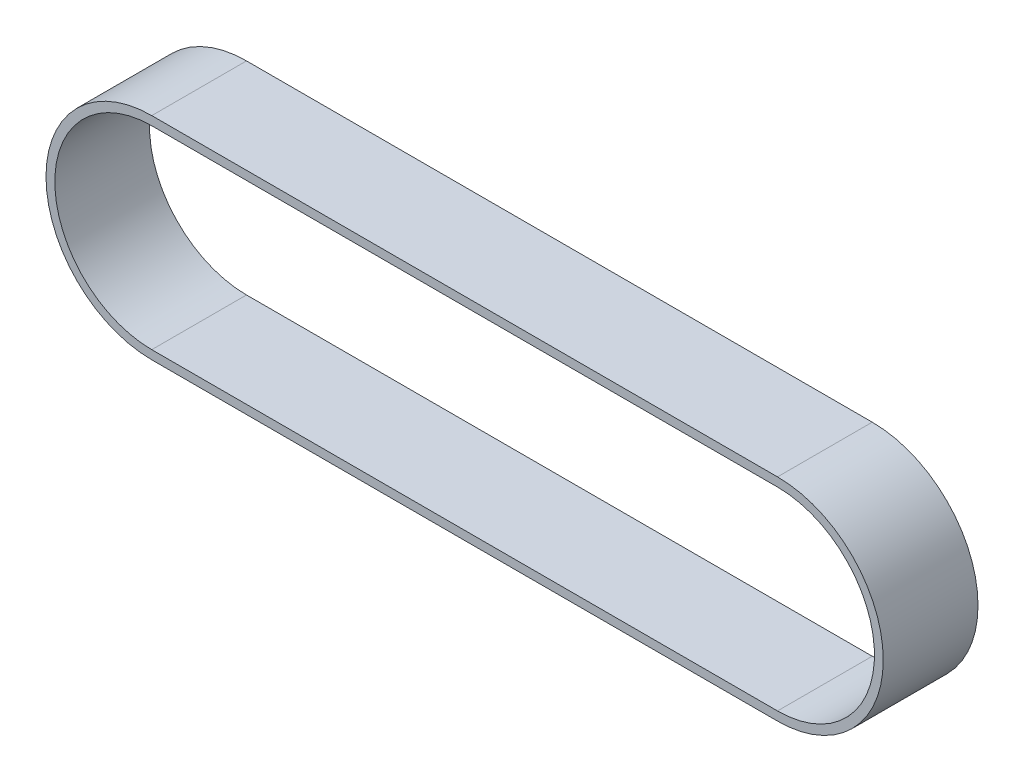
from build123d import *

# Parameters (mm, degrees)
BOSS_EXTRUDE1_DEPTH = 21.5


with BuildPart() as part:
    # Sketch1 → Boss-Extrude1 (new body)
    with BuildSketch(Plane.XY):
        with BuildLine():
            Line((-71, 24), (71, 24))
            ThreePointArc((71, 24), (95, 0), (71, -24))
            Line((71, -24), (-71, -24))
            ThreePointArc((-71, -24), (-95, 0), (-71, 24))
        make_face()
        with BuildLine():
            Line((-71, 22), (71, 22))
            ThreePointArc((71, 22), (93, 0), (71, -22))
            Line((71, -22), (-71, -22))
            ThreePointArc((-71, -22), (-93, 0), (-71, 22))
        make_face(mode=Mode.SUBTRACT)
    extrude(amount=BOSS_EXTRUDE1_DEPTH)


solid = part.part
